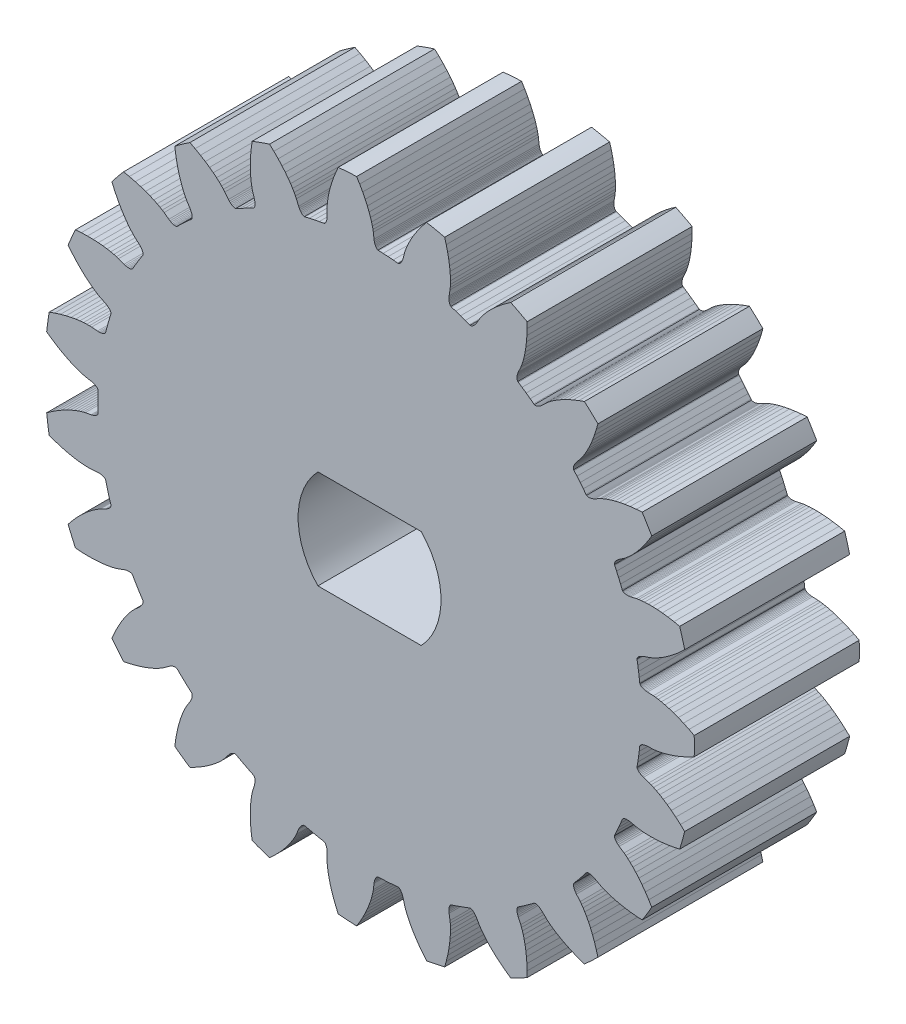
from build123d import *

# Parameters (mm, degrees)
BOSS_EXTRUDE1_DEPTH = 3.175


with BuildPart() as part:
    # Model → Boss-Extrude1 (new, symmetric)
    with BuildSketch(Plane.XY):
        with BuildLine():
            Line((11.7845341, 2.7201057), (11.9632091, 2.8748365))
            Line((11.9632091, 2.8748365), (12.127454742, 3.028948646))
            ThreePointArc((12.127454742, 3.028948646), (12.036454193, 3.372456246), (11.935725978, 3.713238284))
            Line((11.935725978, 3.713238284), (11.7153169, 3.7595754))
            Line((11.7153169, 3.7595754), (11.4822579, 3.7989437))
            Line((11.4822579, 3.7989437), (11.2654754, 3.8262914))
            Line((11.2654754, 3.8262914), (11.0678403, 3.8428655))
            Line((11.0678403, 3.8428655), (10.8876411, 3.8503975))
            Line((10.8876411, 3.8503975), (10.7260469, 3.8503874))
            Line((10.7260469, 3.8503874), (10.5840836, 3.8444145))
            Line((10.5840836, 3.8444145), (10.4619134, 3.8341631))
            Line((10.4619134, 3.8341631), (10.3588581, 3.82117))
            Line((10.3588581, 3.82117), (10.2752035, 3.807086))
            Line((10.2752035, 3.807086), (10.054994, 3.7556019))
            Line((10.054994, 3.7556019), (10.0021064, 3.7473918))
            Line((10.0021064, 3.7473918), (9.9533406, 3.7429453))
            Line((9.9533406, 3.7429453), (9.9088313, 3.742103))
            Line((9.9088313, 3.742103), (9.8687068, 3.7446699))
            Line((9.8687068, 3.7446699), (9.8330875, 3.7504692))
            Line((9.8330875, 3.7504692), (9.8020885, 3.7593112))
            Line((9.8020885, 3.7593112), (9.7758158, 3.771002))
            Line((9.7758158, 3.771002), (9.7543793, 3.7853386))
            Line((9.7543793, 3.7853386), (9.7378812, 3.8021364))
            Line((9.7378812, 3.8021364), (9.7243187, 3.8262821))
            Line((9.7243187, 3.8262821), (9.66005, 3.9858149))
            Line((9.66005, 3.9858149), (9.5848581, 4.1632914))
            Line((9.5848581, 4.1632914), (9.5064743, 4.3393815))
            Line((9.5064743, 4.3393815), (9.4337489, 4.495241))
            Line((9.4337489, 4.495241), (9.4253595, 4.5216336))
            Line((9.4253595, 4.5216336), (9.4243439, 4.5451565))
            Line((9.4243439, 4.5451565), (9.4284977, 4.5706085))
            Line((9.4284977, 4.5706085), (9.4378861, 4.5977891))
            Line((9.4378861, 4.5977891), (9.4525826, 4.6264794))
            Line((9.4525826, 4.6264794), (9.4726563, 4.6564697))
            Line((9.4726563, 4.6564697), (9.4981674, 4.6875461))
            Line((9.4981674, 4.6875461), (9.529163, 4.7195002))
            Line((9.529163, 4.7195002), (9.5656978, 4.752105))
            Line((9.5656978, 4.752105), (9.6077967, 4.7851533))
            Line((9.6077967, 4.7851533), (9.7957278, 4.9109498))
            Line((9.7957278, 4.9109498), (9.8631196, 4.9624744))
            Line((9.8631196, 4.9624744), (9.9429562, 5.0289225))
            Line((9.9429562, 5.0289225), (10.0338359, 5.1112117))
            Line((10.0338359, 5.1112117), (10.1350986, 5.2108869))
            Line((10.1350986, 5.2108869), (10.2454026, 5.3289788))
            Line((10.2454026, 5.3289788), (10.3628935, 5.4658158))
            Line((10.3628935, 5.4658158), (10.485677, 5.6215674))
            Line((10.485677, 5.6215674), (10.6136559, 5.7986661))
            Line((10.6136559, 5.7986661), (10.7439593, 5.9958649))
            Line((10.7439593, 5.9958649), (10.86053519, 6.188575018))
            ThreePointArc((10.86053519, 6.188575018), (10.680231999, 6.494792857), (10.491297213, 6.795761714))
            Line((10.491297213, 6.795761714), (10.2665599, 6.7809148))
            Line((10.2665599, 6.7809148), (10.0315219, 6.7559446))
            Line((10.0315219, 6.7559446), (9.8154, 6.723791))
            Line((9.8154, 6.723791), (9.6206221, 6.6864292))
            Line((9.6206221, 6.6864292), (9.445073, 6.6450647))
            Line((9.445073, 6.6450647), (9.289474, 6.6014574))
            Line((9.289474, 6.6014574), (9.1543864, 6.5574048))
            Line((9.1543864, 6.5574048), (9.0395125, 6.5145724))
            Line((9.0395125, 6.5145724), (8.9437842, 6.4742571))
            Line((8.9437842, 6.4742571), (8.8670316, 6.4381256))
            Line((8.8670316, 6.4381256), (8.6688782, 6.3291389))
            Line((8.6688782, 6.3291389), (8.620167, 6.3069643))
            Line((8.620167, 6.3069643), (8.5744092, 6.2895259))
            Line((8.5744092, 6.2895259), (8.5317777, 6.2767064))
            Line((8.5317777, 6.2767064), (8.4924486, 6.2683526))
            Line((8.4924486, 6.2683526), (8.4565854, 6.2643269))
            Line((8.4565854, 6.2643269), (8.4243504, 6.2644776))
            Line((8.4243504, 6.2644776), (8.3958978, 6.2686465))
            Line((8.3958978, 6.2686465), (8.3713884, 6.276668))
            Line((8.3713884, 6.276668), (8.35097, 6.2883918))
            Line((8.35097, 6.2883918), (8.3313961, 6.307983))
            Line((8.3313961, 6.307983), (8.2264691, 6.4442603))
            Line((8.2264691, 6.4442603), (8.106183, 6.594869))
            Line((8.106183, 6.594869), (7.9831974, 6.7432815))
            Line((7.9831974, 6.7432815), (7.8711184, 6.8737402))
            Line((7.8711184, 6.8737402), (7.8559194, 6.8968908))
            Line((7.8559194, 6.8968908), (7.8485951, 6.9192673))
            Line((7.8485951, 6.9192673), (7.845728, 6.9448961))
            Line((7.845728, 6.9448961), (7.8474351, 6.9736018))
            Line((7.8474351, 6.9736018), (7.853846, 7.0051933))
            Line((7.853846, 7.0051933), (7.865084, 7.0394872))
            Line((7.865084, 7.0394872), (7.8812648, 7.0762941))
            Line((7.8812648, 7.0762941), (7.9024899, 7.1154257))
            Line((7.9024899, 7.1154257), (7.9288732, 7.1566785))
            Line((7.9288732, 7.1566785), (7.9604946, 7.1998594))
            Line((7.9604946, 7.1998594), (8.1075173, 7.3716942))
            Line((8.1075173, 7.3716942), (8.1585088, 7.4394902))
            Line((8.1585088, 7.4394902), (8.2174573, 7.5250139))
            Line((8.2174573, 7.5250139), (8.2827656, 7.6287707))
            Line((8.2827656, 7.6287707), (8.3533812, 7.7520699))
            Line((8.3533812, 7.7520699), (8.427734, 7.8955423))
            Line((8.427734, 7.8955423), (8.5039498, 8.0590038))
            Line((8.5039498, 8.0590038), (8.5801589, 8.2421062))
            Line((8.5801589, 8.2421062), (8.6556113, 8.4471659))
            Line((8.6556113, 8.4471659), (8.7278791, 8.6722075))
            Line((8.7278791, 8.6722075), (8.788139523, 8.889223122))
            ThreePointArc((8.788139523, 8.889223122), (8.531905926, 9.135440416), (8.268776972, 9.374274596))
            Line((8.268776972, 9.374274596), (8.0563791, 9.2993448))
            Line((8.0563791, 9.2993448), (7.8367938, 9.2118881))
            Line((7.8367938, 9.2118881), (7.6373612, 9.1226178))
            Line((7.6373612, 9.1226178), (7.4598863, 9.034091))
            Line((7.4598863, 9.034091), (7.3020071, 8.9468979))
            Line((7.3020071, 8.9468979), (7.1639432, 8.8629275))
            Line((7.1639432, 8.8629275), (7.0457503, 8.7840623))
            Line((7.0457503, 8.7840623), (6.9466923, 8.7118257))
            Line((6.9466923, 8.7118257), (6.8653907, 8.6471782))
            Line((6.8653907, 8.6471782), (6.8012325, 8.591679))
            Line((6.8012325, 8.591679), (6.6398315, 8.4332727))
            Line((6.6398315, 8.4332727), (6.5989092, 8.3987782))
            Line((6.5989092, 8.3987782), (6.5595531, 8.3696411))
            Line((6.5595531, 8.3696411), (6.5219611, 8.3457952))
            Line((6.5219611, 8.3457952), (6.4863442, 8.3271403))
            Line((6.4863442, 8.3271403), (6.4528971, 8.3135881))
            Line((6.4528971, 8.3135881), (6.4218168, 8.3050363))
            Line((6.4218168, 8.3050363), (6.3932946, 8.3013742))
            Line((6.3932946, 8.3013742), (6.3675298, 8.3024857))
            Line((6.3675298, 8.3024857), (6.3447056, 8.3082659))
            Line((6.3447056, 8.3082659), (6.3205719, 8.3218496))
            Line((6.3205719, 8.3218496), (6.1827687, 8.4247645))
            Line((6.1827687, 8.4247645), (6.0263094, 8.5373354))
            Line((6.0263094, 8.5373354), (5.8678432, 8.6470632))
            Line((5.8678432, 8.6470632), (5.724723, 8.7424456))
            Line((5.724723, 8.7424456), (5.7038418, 8.760637))
            Line((5.7038418, 8.760637), (5.6907519, 8.7802077))
            Line((5.6907519, 8.7802077), (5.6810766, 8.8041126))
            Line((5.6810766, 8.8041126), (5.6749756, 8.8322144))
            Line((5.6749756, 8.8322144), (5.6726255, 8.864364))
            Line((5.6726255, 8.864364), (5.6741945, 8.9004182))
            Line((5.6741945, 8.9004182), (5.6798449, 8.9402257))
            Line((5.6798449, 8.9402257), (5.6897252, 8.9836327))
            Line((5.6897252, 8.9836327), (5.7040004, 9.0304738))
            Line((5.7040004, 9.0304738), (5.7227991, 9.0805848))
            Line((5.7227991, 9.0805848), (5.8180092, 9.2857137))
            Line((5.8180092, 9.2857137), (5.8488187, 9.3647531))
            Line((5.8488187, 9.3647531), (5.8825073, 9.4630094))
            Line((5.8825073, 9.4630094), (5.9174005, 9.5805386))
            Line((5.9174005, 9.5805386), (5.9521317, 9.7183174))
            Line((5.9521317, 9.7183174), (5.9850189, 9.8765296))
            Line((5.9850189, 9.8765296), (6.0143071, 10.0544922))
            Line((6.0143071, 10.0544922), (6.0382897, 10.2513657))
            Line((6.0382897, 10.2513657), (6.0556197, 10.4691781))
            Line((6.0556197, 10.4691781), (6.0644921, 10.7053722))
            Line((6.0644921, 10.7053722), (6.063967799, 10.930598881))
            ThreePointArc((6.063967799, 10.930598881), (5.750807187, 11.098554299), (5.43299887, 11.257540039))
            Line((5.43299887, 11.257540039), (5.2486935, 11.1280849))
            Line((5.2486935, 11.1280849), (5.0608466, 10.984628))
            Line((5.0608466, 10.984628), (4.8928943, 10.8448618))
            Line((4.8928943, 10.8448618), (4.7458849, 10.7117356))
            Line((4.7458849, 10.7117356), (4.6173847, 10.5851806))
            Line((4.6173847, 10.5851806), (4.5070955, 10.4670749))
            Line((4.5070955, 10.4670749), (4.4145631, 10.3592461))
            Line((4.4145631, 10.3592461), (4.3386676, 10.2629627))
            Line((4.3386676, 10.2629627), (4.2778226, 10.1787776))
            Line((4.2778226, 10.1787776), (4.2310171, 10.1080268))
            Line((4.2310171, 10.1080268), (4.1183388, 9.9119491))
            Line((4.1183388, 9.9119491), (4.0882405, 9.8676931))
            Line((4.0882405, 9.8676931), (4.0582049, 9.8290184))
            Line((4.0582049, 9.8290184), (4.0284405, 9.7959145))
            Line((4.0284405, 9.7959145), (3.9991774, 9.7683421))
            Line((3.9991774, 9.7683421), (3.970627, 9.7462685))
            Line((3.970627, 9.7462685), (3.9430065, 9.7296485))
            Line((3.9430065, 9.7296485), (3.9165299, 9.718427))
            Line((3.9165299, 9.718427), (3.8914207, 9.712546))
            Line((3.8914207, 9.712546), (3.8678834, 9.711954))
            Line((3.8678834, 9.711954), (3.8409798, 9.7185227))
            Line((3.8409798, 9.7185227), (3.6805206, 9.7804424))
            Line((3.6805206, 9.7804424), (3.4994919, 9.8466266))
            Line((3.4994919, 9.8466266), (3.3172979, 9.9095318))
            Line((3.3172979, 9.9095318), (3.1537512, 9.9627638))
            Line((3.1537512, 9.9627638), (3.1287362, 9.9746469))
            Line((3.1287362, 9.9746469), (3.1108517, 9.9899603))
            Line((3.1108517, 9.9899603), (3.0950857, 10.0103684))
            Line((3.0950857, 10.0103684), (3.0816292, 10.035782))
            Line((3.0816292, 10.035782), (3.0706924, 10.0661054))
            Line((3.0706924, 10.0661054), (3.0624758, 10.1012459))
            Line((3.0624758, 10.1012459), (3.0571768, 10.1411017))
            Line((3.0571768, 10.1411017), (3.0549797, 10.1855647))
            Line((3.0549797, 10.1855647), (3.0560879, 10.2345202))
            Line((3.0560879, 10.2345202), (3.0606697, 10.2878448))
            Line((3.0606697, 10.2878448), (3.0970061, 10.5110544))
            Line((3.0970061, 10.5110544), (3.1053485, 10.595475))
            Line((3.1053485, 10.595475), (3.1112785, 10.6991769))
            Line((3.1112785, 10.6991769), (3.1131689, 10.8217618))
            Line((3.1131689, 10.8217618), (3.1094399, 10.9638018))
            Line((3.1094399, 10.9638018), (3.0984224, 11.1250199))
            Line((3.0984224, 11.1250199), (3.0786107, 11.304285))
            Line((3.0786107, 11.304285), (3.0485882, 11.5003283))
            Line((3.0485882, 11.5003283), (3.0065105, 11.7147392))
            Line((3.0065105, 11.7147392), (2.9513294, 11.9445683))
            Line((2.9513294, 11.9445683), (2.890059148, 12.161301485))
            ThreePointArc((2.890059148, 12.161301485), (2.543197546, 12.238539014), (2.194280578, 12.305885551))
            Line((2.194280578, 12.305885551), (2.0517363, 12.1315059))
            Line((2.0517363, 12.1315059), (1.9095595, 11.9426882))
            Line((1.9095595, 11.9426882), (1.7855438, 11.762792))
            Line((1.7855438, 11.762792), (1.6799029, 11.5949399))
            Line((1.6799029, 11.5949399), (1.590312, 11.4384088))
            Line((1.590312, 11.4384088), (1.5159772, 11.2949271))
            Line((1.5159772, 11.2949271), (1.455968, 11.1661321))
            Line((1.455968, 11.1661321), (1.4088639, 11.0529427))
            Line((1.4088639, 11.0529427), (1.372988, 10.9554637))
            Line((1.372988, 10.9554637), (1.3470065, 10.8747085))
            Line((1.3470065, 10.8747085), (1.2914077, 10.6555017))
            Line((1.2914077, 10.6555017), (1.2743657, 10.6047664))
            Line((1.2743657, 10.6047664), (1.2558782, 10.5594223))
            Line((1.2558782, 10.5594223), (1.2361489, 10.5195156))
            Line((1.2361489, 10.5195156), (1.2154099, 10.4850706))
            Line((1.2154099, 10.4850706), (1.1938736, 10.4561128))
            Line((1.1938736, 10.4561128), (1.1717613, 10.4326571))
            Line((1.1717613, 10.4326571), (1.1492941, 10.4147085))
            Line((1.1492941, 10.4147085), (1.1267027, 10.4022712))
            Line((1.1267027, 10.4022712), (1.104198, 10.3953508))
            Line((1.104198, 10.3953508), (1.0765198, 10.3944175))
            Line((1.0765198, 10.3944175), (0.9053052, 10.4107497))
            Line((0.9053052, 10.4107497), (0.7131332, 10.4256386))
            Line((0.7131332, 10.4256386), (0.5207238, 10.4370557))
            Line((0.5207238, 10.4370557), (0.34888, 10.4441894))
            Line((0.34888, 10.4441894), (0.3215867, 10.4488829))
            Line((0.3215867, 10.4488829), (0.3002339, 10.4588032))
            Line((0.3002339, 10.4588032), (0.2795464, 10.4742009))
            Line((0.2795464, 10.4742009), (0.2597325, 10.4950416))
            Line((0.2597325, 10.4950416), (0.2410201, 10.5212898))
            Line((0.2410201, 10.5212898), (0.2236274, 10.5529104))
            Line((0.2236274, 10.5529104), (0.2077719, 10.5898586))
            Line((0.2077719, 10.5898586), (0.1936603, 10.63208))
            Line((0.1936603, 10.63208), (0.1815193, 10.6795191))
            Line((0.1815193, 10.6795191), (0.1715445, 10.7321024))
            Line((0.1715445, 10.7321024), (0.1463122, 10.9568382))
            Line((0.1463122, 10.9568382), (0.1315688, 11.0403791))
            Line((0.1315688, 11.0403791), (0.1093005, 11.1418353))
            Line((0.1093005, 11.1418353), (0.0780478, 11.2603844))
            Line((0.0780478, 11.2603844), (0.0361351, 11.3961511))
            Line((0.0361351, 11.3961511), (-0.01797, 11.5484183))
            Line((-0.01797, 11.5484183), (-0.0854121, 11.7156907))
            Line((-0.0854121, 11.7156907), (-0.1672132, 11.8963642))
            Line((-0.1672132, 11.8963642), (-0.2655779, 12.0914717))
            Line((-0.2655779, 12.0914717), (-0.3807198, 12.2978905))
            Line((-0.3807198, 12.2978905), (-0.49819194, 12.490055965))
            ThreePointArc((-0.49819194, 12.490055965), (-0.853029389, 12.470847266), (-1.207177431, 12.44155983))
            Line((-1.207177431, 12.44155983), (-1.2973888, 12.2351886))
            Line((-1.2973888, 12.2351886), (-1.3833509, 12.0150139))
            Line((-1.3833509, 12.0150139), (-1.4542323, 11.8083297))
            Line((-1.4542323, 11.8083297), (-1.5106698, 11.6182004))
            Line((-1.5106698, 11.6182004), (-1.5547068, 11.4433027))
            Line((-1.5547068, 11.4433027), (-1.5875742, 11.2850864))
            Line((-1.5875742, 11.2850864), (-1.6106096, 11.1448771))
            Line((-1.6106096, 11.1448771), (-1.6254289, 11.0231765))
            Line((-1.6254289, 11.0231765), (-1.6336748, 10.9196331))
            Line((-1.6336748, 10.9196331), (-1.6369054, 10.8348628))
            Line((-1.6369054, 10.8348628), (-1.6313011, 10.6087844))
            Line((-1.6313011, 10.6087844), (-1.634023, 10.5553326))
            Line((-1.634023, 10.5553326), (-1.6395912, 10.5066822))
            Line((-1.6395912, 10.5066822), (-1.6478222, 10.4629324))
            Line((-1.6478222, 10.4629324), (-1.658499, 10.4241694))
            Line((-1.658499, 10.4241694), (-1.671424, 10.390475))
            Line((-1.671424, 10.390475), (-1.6863879, 10.3619233))
            Line((-1.6863879, 10.3619233), (-1.7031796, 10.3385787))
            Line((-1.7031796, 10.3385787), (-1.7215777, 10.3205075))
            Line((-1.7215777, 10.3205075), (-1.7413808, 10.3077721))
            Line((-1.7413808, 10.3077721), (-1.7677808, 10.2994058))
            Line((-1.7677808, 10.2994058), (-1.9370527, 10.2689392))
            Line((-1.9370527, 10.2689392), (-2.1261153, 10.2314287))
            Line((-2.1261153, 10.2314287), (-2.31447, 10.190511))
            Line((-2.31447, 10.190511), (-2.481866, 10.1510172))
            Line((-2.481866, 10.1510172), (-2.5094135, 10.148173))
            Line((-2.5094135, 10.148173), (-2.5326509, 10.1519645))
            Line((-2.5326509, 10.1519645), (-2.5567255, 10.1612098))
            Line((-2.5567255, 10.1612098), (-2.5814275, 10.175932))
            Line((-2.5814275, 10.175932), (-2.6065276, 10.1961582))
            Line((-2.6065276, 10.1961582), (-2.6318065, 10.2219138))
            Line((-2.6318065, 10.2219138), (-2.6570425, 10.253214))
            Line((-2.6570425, 10.253214), (-2.682022, 10.2900625))
            Line((-2.682022, 10.2900625), (-2.7065117, 10.3324669))
            Line((-2.7065117, 10.3324669), (-2.7303034, 10.3804091))
            Line((-2.7303034, 10.3804091), (-2.8152331, 10.5900035))
            Line((-2.8152331, 10.5900035), (-2.8519687, 10.6664687))
            Line((-2.8519687, 10.6664687), (-2.9007838, 10.7581547))
            Line((-2.9007838, 10.7581547), (-2.9628618, 10.8638758))
            Line((-2.9628618, 10.8638758), (-3.0398497, 10.9833))
            Line((-3.0398497, 10.9833), (-3.1330296, 11.1153234))
            Line((-3.1330296, 11.1153234), (-3.2431003, 11.2581972))
            Line((-3.2431003, 11.2581972), (-3.3706131, 11.4101012))
            Line((-3.3706131, 11.4101012), (-3.5179696, 11.5714351))
            Line((-3.5179696, 11.5714351), (-3.6845328, 11.7391343))
            Line((-3.6845328, 11.7391343), (-3.8494943, 11.8924802))
            ThreePointArc((-3.8494943, 11.8924802), (-4.185991025, 11.778249896), (-4.5191047, 11.6545006))
            Line((-4.5191047, 11.6545006), (-4.5502924, 11.4314433))
            Line((-4.5502924, 11.4314433), (-4.5736644, 11.196241))
            Line((-4.5736644, 11.196241), (-4.5861546, 10.9780976))
            Line((-4.5861546, 10.9780976), (-4.589203, 10.7797922))
            Line((-4.589203, 10.7797922), (-4.5844202, 10.5994991))
            Line((-4.5844202, 10.5994991), (-4.5733825, 10.4382823))
            Line((-4.5733825, 10.4382823), (-4.5577357, 10.2970575))
            Line((-4.5577357, 10.2970575), (-4.539171, 10.1758718))
            Line((-4.539171, 10.1758718), (-4.5191755, 10.0739433))
            Line((-4.5191755, 10.0739433), (-4.4994155, 9.9914449))
            Line((-4.4994155, 9.9914449), (-4.4330238, 9.7752621))
            Line((-4.4330238, 9.7752621), (-4.4212236, 9.7230581))
            Line((-4.4212236, 9.7230581), (-4.4134596, 9.6747095))
            Line((-4.4134596, 9.6747095), (-4.4095819, 9.6303614))
            Line((-4.4095819, 9.6303614), (-4.4094046, 9.5901553))
            Line((-4.4094046, 9.5901553), (-4.4127596, 9.5542232))
            Line((-4.4127596, 9.5542232), (-4.4194656, 9.5226931))
            Line((-4.4194656, 9.5226931), (-4.4293362, 9.4956838))
            Line((-4.4293362, 9.4956838), (-4.4421765, 9.473319))
            Line((-4.4421765, 9.473319), (-4.4578093, 9.455713))
            Line((-4.4578093, 9.455713), (-4.4809731, 9.4405344))
            Line((-4.4809731, 9.4405344), (-4.6357481, 9.3655285))
            Line((-4.6357481, 9.3655285), (-4.8076796, 9.2784005))
            Line((-4.8076796, 9.2784005), (-4.9780101, 9.1881827))
            Line((-4.9780101, 9.1881827), (-5.1285433, 9.1049905))
            Line((-5.1285433, 9.1049905), (-5.154302, 9.0948196))
            Line((-5.154302, 9.0948196), (-5.1777006, 9.0922011))
            Line((-5.1777006, 9.0922011), (-5.2033768, 9.0946083))
            Line((-5.2033768, 9.0946083), (-5.2311347, 9.10212))
            Line((-5.2311347, 9.10212), (-5.2607611, 9.1148243))
            Line((-5.2607611, 9.1148243), (-5.2920513, 9.1328046))
            Line((-5.2920513, 9.1328046), (-5.3247962, 9.1561356))
            Line((-5.3247962, 9.1561356), (-5.358791, 9.1848782))
            Line((-5.358791, 9.1848782), (-5.3938131, 9.2191029))
            Line((-5.3938131, 9.2191029), (-5.4296572, 9.2588483))
            Line((-5.4296572, 9.2588483), (-5.5679853, 9.4377566))
            Line((-5.5679853, 9.4377566), (-5.6239888, 9.5014752))
            Line((-5.6239888, 9.5014752), (-5.6957303, 9.576591))
            Line((-5.6957303, 9.576591), (-5.7840295, 9.6616433))
            Line((-5.7840295, 9.6616433), (-5.8903827, 9.7558679))
            Line((-5.8903827, 9.7558679), (-6.0157267, 9.8578558))
            Line((-6.0157267, 9.8578558), (-6.1602626, 9.9657347))
            Line((-6.1602626, 9.9657347), (-6.3240301, 10.0776031))
            Line((-6.3240301, 10.0776031), (-6.5094495, 10.193198))
            Line((-6.5094495, 10.193198), (-6.7150809, 10.3097403))
            Line((-6.7150809, 10.3097403), (-6.915297648, 10.412893728))
            ThreePointArc((-6.915297648, 10.412893728), (-7.208497005, 10.212113457), (-7.495870563, 10.003079924))
            Line((-7.495870563, 10.003079924), (-7.4657217, 9.7798802))
            Line((-7.4657217, 9.7798802), (-7.4247702, 9.5470941))
            Line((-7.4247702, 9.5470941), (-7.3779429, 9.3336703))
            Line((-7.3779429, 9.3336703), (-7.327376, 9.1418961))
            Line((-7.327376, 9.1418961), (-7.2741281, 8.9695791))
            Line((-7.2741281, 8.9695791), (-7.220004, 8.8173187))
            Line((-7.220004, 8.8173187), (-7.1668354, 8.6855523))
            Line((-7.1668354, 8.6855523), (-7.1162636, 8.5738692))
            Line((-7.1162636, 8.5738692), (-7.0695096, 8.4811152))
            Line((-7.0695096, 8.4811152), (-7.0282245, 8.4070073))
            Line((-7.0282245, 8.4070073), (-6.9059694, 8.2167534))
            Line((-6.9059694, 8.2167534), (-6.8805223, 8.1696689))
            Line((-6.8805223, 8.1696689), (-6.860002, 8.1252078))
            Line((-6.860002, 8.1252078), (-6.844303, 8.0835505))
            Line((-6.844303, 8.0835505), (-6.8332848, 8.0448832))
            Line((-6.8332848, 8.0448832), (-6.8268211, 8.0093784))
            Line((-6.8268211, 8.0093784), (-6.8247716, 7.9772082))
            Line((-6.8247716, 7.9772082), (-6.8269892, 7.9485375))
            Line((-6.8269892, 7.9485375), (-6.8333194, 7.9235377))
            Line((-6.8333194, 7.9235377), (-6.8436225, 7.902367))
            Line((-6.8436225, 7.902367), (-6.8618322, 7.8815017))
            Line((-6.8618322, 7.8815017), (-6.9906314, 7.7675195))
            Line((-6.9906314, 7.7675195), (-7.1326803, 7.6372358))
            Line((-7.1326803, 7.6372358), (-7.272354, 7.5044089))
            Line((-7.272354, 7.5044089), (-7.3948601, 7.3836884))
            Line((-7.3948601, 7.3836884), (-7.4169194, 7.366945))
            Line((-7.4169194, 7.366945), (-7.4387439, 7.3581107))
            Line((-7.4387439, 7.3581107), (-7.4641174, 7.3535013))
            Line((-7.4641174, 7.3535013), (-7.4928726, 7.3532455))
            Line((-7.4928726, 7.3532455), (-7.5248279, 7.3574855))
            Line((-7.5248279, 7.3574855), (-7.5598089, 7.3663571))
            Line((-7.5598089, 7.3663571), (-7.5976341, 7.3799884))
            Line((-7.5976341, 7.3799884), (-7.638123, 7.3984935))
            Line((-7.638123, 7.3984935), (-7.6810801, 7.4220002))
            Line((-7.6810801, 7.4220002), (-7.7263182, 7.4506011))
            Line((-7.7263182, 7.4506011), (-7.9077856, 7.5855546))
            Line((-7.9077856, 7.5855546), (-7.9789034, 7.6318007))
            Line((-7.9789034, 7.6318007), (-8.0682505, 7.6847754))
            Line((-8.0682505, 7.6847754), (-8.1762221, 7.7428509))
            Line((-8.1762221, 7.7428509), (-8.304053, 7.8048876))
            Line((-8.304053, 7.8048876), (-8.4522649, 7.8692761))
            Line((-8.4522649, 7.8692761), (-8.6205464, 7.9341593))
            Line((-8.6205464, 7.9341593), (-8.8084227, 7.9976954))
            Line((-8.8084227, 7.9976954), (-9.0181534, 8.0589781))
            Line((-9.0181534, 8.0589781), (-9.2476021, 8.1157201))
            Line((-9.2476021, 8.1157201), (-9.468224658, 8.161030453))
            ThreePointArc((-9.468224658, 8.161030453), (-9.69638161, 7.88859142), (-9.916702096, 7.609776958))
            Line((-9.916702096, 7.609776958), (-9.8274526, 7.4029881))
            Line((-9.8274526, 7.4029881), (-9.7252148, 7.1898829))
            Line((-9.7252148, 7.1898829), (-9.6225428, 6.9970073))
            Line((-9.6225428, 6.9970073), (-9.5221111, 6.8259874))
            Line((-9.5221111, 6.8259874), (-9.4243472, 6.6744265))
            Line((-9.4243472, 6.6744265), (-9.3311508, 6.5424148))
            Line((-9.3311508, 6.5424148), (-9.2444036, 6.4298794))
            Line((-9.2444036, 6.4298794), (-9.1655754, 6.3359819))
            Line((-9.1655754, 6.3359819), (-9.0955305, 6.2592816))
            Line((-9.0955305, 6.2592816), (-9.0357823, 6.1990604))
            Line((-9.0357823, 6.1990604), (-8.8667309, 6.0488456))
            Line((-8.8667309, 6.0488456), (-8.8295242, 6.0103727))
            Line((-8.8295242, 6.0103727), (-8.7977693, 5.9730967))
            Line((-8.7977693, 5.9730967), (-8.7714136, 5.9372197))
            Line((-8.7714136, 5.9372197), (-8.7503716, 5.9029589))
            Line((-8.7503716, 5.9029589), (-8.7345685, 5.8705146))
            Line((-8.7345685, 5.8705146), (-8.7239156, 5.8400904))
            Line((-8.7239156, 5.8400904), (-8.7183157, 5.8118845))
            Line((-8.7183157, 5.8118845), (-8.7176663, 5.786104))
            Line((-8.7176663, 5.786104), (-8.7218755, 5.7629385))
            Line((-8.7218755, 5.7629385), (-8.7337805, 5.737934))
            Line((-8.7337805, 5.737934), (-8.8270515, 5.593429))
            Line((-8.8270515, 5.593429), (-8.9286828, 5.4296523))
            Line((-8.9286828, 5.4296523), (-9.0273407, 5.2640674))
            Line((-9.0273407, 5.2640674), (-9.1127339, 5.1147718))
            Line((-9.1127339, 5.1147718), (-9.1294579, 5.0926978))
            Line((-9.1294579, 5.0926978), (-9.1480896, 5.0783029))
            Line((-9.1480896, 5.0783029), (-9.1712786, 5.0670188))
            Line((-9.1712786, 5.0670188), (-9.1988985, 5.0590143))
            Line((-9.1988985, 5.0590143), (-9.2308127, 5.0544757))
            Line((-9.2308127, 5.0544757), (-9.26689, 5.0535806))
            Line((-9.26689, 5.0535806), (-9.3069903, 5.0565012))
            Line((-9.3069903, 5.0565012), (-9.3509703, 5.0633964))
            Line((-9.3509703, 5.0633964), (-9.3986765, 5.0744417))
            Line((-9.3986765, 5.0744417), (-9.4499535, 5.0897769))
            Line((-9.4499535, 5.0897769), (-9.6611016, 5.1707666))
            Line((-9.6611016, 5.1707666), (-9.7420592, 5.1961104))
            Line((-9.7420592, 5.1961104), (-9.8423855, 5.2230152))
            Line((-9.8423855, 5.2230152), (-9.9620218, 5.2498066))
            Line((-9.9620218, 5.2498066), (-10.1018496, 5.2750545))
            Line((-10.1018496, 5.2750545), (-10.2619373, 5.2970683))
            Line((-10.2619373, 5.2970683), (-10.4414837, 5.3141435))
            Line((-10.4414837, 5.3141435), (-10.6395349, 5.3246351))
            Line((-10.6395349, 5.3246351), (-10.8580221, 5.3270607))
            Line((-10.8580221, 5.3270607), (-11.094271, 5.3197939))
            Line((-11.094271, 5.3197939), (-11.318936793, 5.303900786))
            ThreePointArc((-11.318936793, 5.303900786), (-11.465129953, 4.980008598), (-11.602057178, 4.65209165))
            Line((-11.602057178, 4.65209165), (-11.4603263, 4.4770502))
            Line((-11.4603263, 4.4770502), (-11.3043846, 4.299431))
            Line((-11.3043846, 4.299431), (-11.1534828, 4.1414083))
            Line((-11.1534828, 4.1414083), (-11.0106348, 4.0038265))
            Line((-11.0106348, 4.0038265), (-10.8756055, 3.8842622))
            Line((-10.8756055, 3.8842622), (-10.7502488, 3.78229))
            Line((-10.7502488, 3.78229), (-10.6363568, 3.6973318))
            Line((-10.6363568, 3.6973318), (-10.5351185, 3.6281838))
            Line((-10.5351185, 3.6281838), (-10.4469775, 3.5732257))
            Line((-10.4469775, 3.5732257), (-10.3731975, 3.5313575))
            Line((-10.3731975, 3.5313575), (-10.1698875, 3.4323226))
            Line((-10.1698875, 3.4323226), (-10.1236806, 3.4053147))
            Line((-10.1236806, 3.4053147), (-10.0830464, 3.3779883))
            Line((-10.0830464, 3.3779883), (-10.0479884, 3.3505524))
            Line((-10.0479884, 3.3505524), (-10.0184833, 3.3232392))
            Line((-10.0184833, 3.3232392), (-9.9945129, 3.2962616))
            Line((-9.9945129, 3.2962616), (-9.9760467, 3.2698397))
            Line((-9.9760467, 3.2698397), (-9.9630446, 3.2441906))
            Line((-9.9630446, 3.2441906), (-9.9554638, 3.2195413))
            Line((-9.9554638, 3.2195413), (-9.9532669, 3.1960993))
            Line((-9.9532669, 3.1960993), (-9.9579843, 3.1688101))
            Line((-9.9579843, 3.1688101), (-10.0088095, 3.0044995))
            Line((-10.0088095, 3.0044995), (-10.0624857, 2.8193763))
            Line((-10.0624857, 2.8193763), (-10.1128108, 2.6333141))
            Line((-10.1128108, 2.6333141), (-10.1547579, 2.466516))
            Line((-10.1547579, 2.466516), (-10.1649062, 2.4407485))
            Line((-10.1649062, 2.4407485), (-10.1789634, 2.4218606))
            Line((-10.1789634, 2.4218606), (-10.198248, 2.4047386))
            Line((-10.198248, 2.4047386), (-10.2226841, 2.3895792))
            Line((-10.2226841, 2.3895792), (-10.2521904, 2.3765986))
            Line((-10.2521904, 2.3765986), (-10.2866883, 2.3660031))
            Line((-10.2866883, 2.3660031), (-10.3260896, 2.3579965))
            Line((-10.3260896, 2.3579965), (-10.370299, 2.3527703))
            Line((-10.370299, 2.3527703), (-10.419216, 2.3505351))
            Line((-10.419216, 2.3505351), (-10.4727289, 2.3514672))
            Line((-10.4727289, 2.3514672), (-10.6978979, 2.3724865))
            Line((-10.6978979, 2.3724865), (-10.782691, 2.3750485))
            Line((-10.782691, 2.3750485), (-10.8865558, 2.3738878))
            Line((-10.8865558, 2.3738878), (-11.0089839, 2.3674082))
            Line((-11.0089839, 2.3674082), (-11.1504383, 2.3539948))
            Line((-11.1504383, 2.3539948), (-11.3105287, 2.3320011))
            Line((-11.3105287, 2.3320011), (-11.488024, 2.3000021))
            Line((-11.488024, 2.3000021), (-11.6815614, 2.256671))
            Line((-11.6815614, 2.256671), (-11.892601, 2.2000595))
            Line((-11.892601, 2.2000595), (-12.1181286, 2.129323))
            Line((-12.1181286, 2.129323), (-12.3301751, 2.0534052))
            ThreePointArc((-12.3301751, 2.0534052), (-12.383562047, 1.702081397), (-12.4269408, 1.349382))
            Line((-12.4269408, 1.349382), (-12.24324, 1.21907))
            Line((-12.24324, 1.21907), (-12.04516, 1.09011))
            Line((-12.04516, 1.09011), (-11.85722, 0.97866))
            Line((-11.85722, 0.97866), (-11.68255, 0.88472))
            Line((-11.68255, 0.88472), (-11.52027, 0.80602))
            Line((-11.52027, 0.80602), (-11.37205, 0.74165))
            Line((-11.37205, 0.74165), (-11.23946, 0.69057))
            Line((-11.23946, 0.69057), (-11.12332, 0.6513))
            Line((-11.12332, 0.6513), (-11.02362, 0.62216))
            Line((-11.02362, 0.62216), (-10.94128, 0.60175))
            Line((-10.94128, 0.60175), (-10.71879, 0.56124))
            Line((-10.71879, 0.56124), (-10.66701, 0.5477))
            Line((-10.66701, 0.5477), (-10.62051, 0.53235))
            Line((-10.62051, 0.53235), (-10.57935, 0.51539))
            Line((-10.57935, 0.51539), (-10.54357, 0.49705))
            Line((-10.54357, 0.49705), (-10.51321, 0.47754))
            Line((-10.51321, 0.47754), (-10.4883, 0.45708))
            Line((-10.4883, 0.45708), (-10.46886, 0.43589))
            Line((-10.46886, 0.43589), (-10.45491, 0.4142))
            Line((-10.45491, 0.4142), (-10.44647, 0.39222))
            Line((-10.44647, 0.39222), (-10.44365, 0.36467))
            Line((-10.44365, 0.36467), (-10.44826, 0.19274))
            Line((-10.44826, 0.19274), (-10.45, 0))
            Line((-10.45, 0), (-10.44826, -0.19274))
            Line((-10.44826, -0.19274), (-10.44365, -0.36467))
            Line((-10.44365, -0.36467), (-10.44647, -0.39222))
            Line((-10.44647, -0.39222), (-10.45491, -0.4142))
            Line((-10.45491, -0.4142), (-10.46886, -0.43589))
            Line((-10.46886, -0.43589), (-10.4883, -0.45708))
            Line((-10.4883, -0.45708), (-10.51321, -0.47754))
            Line((-10.51321, -0.47754), (-10.54357, -0.49705))
            Line((-10.54357, -0.49705), (-10.57935, -0.51539))
            Line((-10.57935, -0.51539), (-10.62051, -0.53235))
            Line((-10.62051, -0.53235), (-10.66701, -0.5477))
            Line((-10.66701, -0.5477), (-10.71879, -0.56124))
            Line((-10.71879, -0.56124), (-10.94128, -0.60175))
            Line((-10.94128, -0.60175), (-11.02362, -0.62216))
            Line((-11.02362, -0.62216), (-11.12332, -0.6513))
            Line((-11.12332, -0.6513), (-11.23946, -0.69057))
            Line((-11.23946, -0.69057), (-11.37205, -0.74165))
            Line((-11.37205, -0.74165), (-11.52027, -0.80602))
            Line((-11.52027, -0.80602), (-11.68255, -0.88472))
            Line((-11.68255, -0.88472), (-11.85722, -0.97866))
            Line((-11.85722, -0.97866), (-12.04516, -1.09011))
            Line((-12.04516, -1.09011), (-12.24324, -1.21907))
            Line((-12.24324, -1.21907), (-12.426941046, -1.349382175))
            ThreePointArc((-12.426941046, -1.349382175), (-12.383562028, -1.702081539), (-12.330174816, -2.053405302))
            Line((-12.330174816, -2.053405302), (-12.1181286, -2.129323))
            Line((-12.1181286, -2.129323), (-11.892601, -2.2000595))
            Line((-11.892601, -2.2000595), (-11.6815614, -2.256671))
            Line((-11.6815614, -2.256671), (-11.488024, -2.3000021))
            Line((-11.488024, -2.3000021), (-11.3105287, -2.3320011))
            Line((-11.3105287, -2.3320011), (-11.1504383, -2.3539948))
            Line((-11.1504383, -2.3539948), (-11.0089839, -2.3674082))
            Line((-11.0089839, -2.3674082), (-10.8865558, -2.3738878))
            Line((-10.8865558, -2.3738878), (-10.782691, -2.3750485))
            Line((-10.782691, -2.3750485), (-10.6978979, -2.3724865))
            Line((-10.6978979, -2.3724865), (-10.4727289, -2.3514672))
            Line((-10.4727289, -2.3514672), (-10.419216, -2.3505351))
            Line((-10.419216, -2.3505351), (-10.370299, -2.3527703))
            Line((-10.370299, -2.3527703), (-10.3260896, -2.3579965))
            Line((-10.3260896, -2.3579965), (-10.2866883, -2.3660031))
            Line((-10.2866883, -2.3660031), (-10.2521904, -2.3765986))
            Line((-10.2521904, -2.3765986), (-10.2226841, -2.3895792))
            Line((-10.2226841, -2.3895792), (-10.198248, -2.4047386))
            Line((-10.198248, -2.4047386), (-10.1789634, -2.4218606))
            Line((-10.1789634, -2.4218606), (-10.1649062, -2.4407485))
            Line((-10.1649062, -2.4407485), (-10.1547579, -2.466516))
            Line((-10.1547579, -2.466516), (-10.1128108, -2.6333141))
            Line((-10.1128108, -2.6333141), (-10.0624857, -2.8193763))
            Line((-10.0624857, -2.8193763), (-10.0088095, -3.0044995))
            Line((-10.0088095, -3.0044995), (-9.9579843, -3.1688101))
            Line((-9.9579843, -3.1688101), (-9.9532669, -3.1960993))
            Line((-9.9532669, -3.1960993), (-9.9554638, -3.2195413))
            Line((-9.9554638, -3.2195413), (-9.9630446, -3.2441906))
            Line((-9.9630446, -3.2441906), (-9.9760467, -3.2698397))
            Line((-9.9760467, -3.2698397), (-9.9945129, -3.2962616))
            Line((-9.9945129, -3.2962616), (-10.0184833, -3.3232392))
            Line((-10.0184833, -3.3232392), (-10.0479884, -3.3505524))
            Line((-10.0479884, -3.3505524), (-10.0830464, -3.3779883))
            Line((-10.0830464, -3.3779883), (-10.1236806, -3.4053147))
            Line((-10.1236806, -3.4053147), (-10.1698875, -3.4323226))
            Line((-10.1698875, -3.4323226), (-10.3731975, -3.5313575))
            Line((-10.3731975, -3.5313575), (-10.4469775, -3.5732257))
            Line((-10.4469775, -3.5732257), (-10.5351185, -3.6281838))
            Line((-10.5351185, -3.6281838), (-10.6363568, -3.6973318))
            Line((-10.6363568, -3.6973318), (-10.7502488, -3.78229))
            Line((-10.7502488, -3.78229), (-10.8756055, -3.8842622))
            Line((-10.8756055, -3.8842622), (-11.0106348, -4.0038265))
            Line((-11.0106348, -4.0038265), (-11.1534828, -4.1414083))
            Line((-11.1534828, -4.1414083), (-11.3043846, -4.299431))
            Line((-11.3043846, -4.299431), (-11.4603263, -4.4770502))
            Line((-11.4603263, -4.4770502), (-11.602057378, -4.652091897))
            ThreePointArc((-11.602057378, -4.652091897), (-11.465129893, -4.980008736), (-11.318936476, -5.303900809))
            Line((-11.318936476, -5.303900809), (-11.094271, -5.3197939))
            Line((-11.094271, -5.3197939), (-10.8580221, -5.3270607))
            Line((-10.8580221, -5.3270607), (-10.6395349, -5.3246351))
            Line((-10.6395349, -5.3246351), (-10.4414837, -5.3141435))
            Line((-10.4414837, -5.3141435), (-10.2619373, -5.2970683))
            Line((-10.2619373, -5.2970683), (-10.1018496, -5.2750545))
            Line((-10.1018496, -5.2750545), (-9.9620218, -5.2498066))
            Line((-9.9620218, -5.2498066), (-9.8423855, -5.2230152))
            Line((-9.8423855, -5.2230152), (-9.7420592, -5.1961104))
            Line((-9.7420592, -5.1961104), (-9.6611016, -5.1707666))
            Line((-9.6611016, -5.1707666), (-9.4499535, -5.0897769))
            Line((-9.4499535, -5.0897769), (-9.3986765, -5.0744417))
            Line((-9.3986765, -5.0744417), (-9.3509703, -5.0633964))
            Line((-9.3509703, -5.0633964), (-9.3069903, -5.0565012))
            Line((-9.3069903, -5.0565012), (-9.26689, -5.0535806))
            Line((-9.26689, -5.0535806), (-9.2308127, -5.0544757))
            Line((-9.2308127, -5.0544757), (-9.1988985, -5.0590143))
            Line((-9.1988985, -5.0590143), (-9.1712786, -5.0670188))
            Line((-9.1712786, -5.0670188), (-9.1480896, -5.0783029))
            Line((-9.1480896, -5.0783029), (-9.1294579, -5.0926978))
            Line((-9.1294579, -5.0926978), (-9.1127339, -5.1147718))
            Line((-9.1127339, -5.1147718), (-9.0273407, -5.2640674))
            Line((-9.0273407, -5.2640674), (-8.9286828, -5.4296523))
            Line((-8.9286828, -5.4296523), (-8.8270515, -5.593429))
            Line((-8.8270515, -5.593429), (-8.7337805, -5.737934))
            Line((-8.7337805, -5.737934), (-8.7218755, -5.7629385))
            Line((-8.7218755, -5.7629385), (-8.7176663, -5.786104))
            Line((-8.7176663, -5.786104), (-8.7183157, -5.8118845))
            Line((-8.7183157, -5.8118845), (-8.7239156, -5.8400904))
            Line((-8.7239156, -5.8400904), (-8.7345685, -5.8705146))
            Line((-8.7345685, -5.8705146), (-8.7503716, -5.9029589))
            Line((-8.7503716, -5.9029589), (-8.7714136, -5.9372197))
            Line((-8.7714136, -5.9372197), (-8.7977693, -5.9730967))
            Line((-8.7977693, -5.9730967), (-8.8295242, -6.0103727))
            Line((-8.8295242, -6.0103727), (-8.8667309, -6.0488456))
            Line((-8.8667309, -6.0488456), (-9.0357823, -6.1990604))
            Line((-9.0357823, -6.1990604), (-9.0955305, -6.2592816))
            Line((-9.0955305, -6.2592816), (-9.1655754, -6.3359819))
            Line((-9.1655754, -6.3359819), (-9.2444036, -6.4298794))
            Line((-9.2444036, -6.4298794), (-9.3311508, -6.5424148))
            Line((-9.3311508, -6.5424148), (-9.4243472, -6.6744265))
            Line((-9.4243472, -6.6744265), (-9.5221111, -6.8259874))
            Line((-9.5221111, -6.8259874), (-9.6225428, -6.9970073))
            Line((-9.6225428, -6.9970073), (-9.7252148, -7.1898829))
            Line((-9.7252148, -7.1898829), (-9.8274526, -7.4029881))
            Line((-9.8274526, -7.4029881), (-9.916702218, -7.609777242))
            ThreePointArc((-9.916702218, -7.609777242), (-9.696381516, -7.888591534), (-9.468224355, -8.161030391))
            Line((-9.468224355, -8.161030391), (-9.2476021, -8.1157201))
            Line((-9.2476021, -8.1157201), (-9.0181534, -8.0589781))
            Line((-9.0181534, -8.0589781), (-8.8084227, -7.9976954))
            Line((-8.8084227, -7.9976954), (-8.6205464, -7.9341593))
            Line((-8.6205464, -7.9341593), (-8.4522649, -7.8692761))
            Line((-8.4522649, -7.8692761), (-8.304053, -7.8048876))
            Line((-8.304053, -7.8048876), (-8.1762221, -7.7428509))
            Line((-8.1762221, -7.7428509), (-8.0682505, -7.6847754))
            Line((-8.0682505, -7.6847754), (-7.9789034, -7.6318007))
            Line((-7.9789034, -7.6318007), (-7.9077856, -7.5855546))
            Line((-7.9077856, -7.5855546), (-7.7263182, -7.4506011))
            Line((-7.7263182, -7.4506011), (-7.6810801, -7.4220002))
            Line((-7.6810801, -7.4220002), (-7.638123, -7.3984935))
            Line((-7.638123, -7.3984935), (-7.5976341, -7.3799884))
            Line((-7.5976341, -7.3799884), (-7.5598089, -7.3663571))
            Line((-7.5598089, -7.3663571), (-7.5248279, -7.3574855))
            Line((-7.5248279, -7.3574855), (-7.4928726, -7.3532455))
            Line((-7.4928726, -7.3532455), (-7.4641174, -7.3535013))
            Line((-7.4641174, -7.3535013), (-7.4387439, -7.3581107))
            Line((-7.4387439, -7.3581107), (-7.4169194, -7.366945))
            Line((-7.4169194, -7.366945), (-7.3948601, -7.3836884))
            Line((-7.3948601, -7.3836884), (-7.272354, -7.5044089))
            Line((-7.272354, -7.5044089), (-7.1326803, -7.6372358))
            Line((-7.1326803, -7.6372358), (-6.9906314, -7.7675195))
            Line((-6.9906314, -7.7675195), (-6.8618322, -7.8815017))
            Line((-6.8618322, -7.8815017), (-6.8436225, -7.902367))
            Line((-6.8436225, -7.902367), (-6.8333194, -7.9235377))
            Line((-6.8333194, -7.9235377), (-6.8269892, -7.9485375))
            Line((-6.8269892, -7.9485375), (-6.8247716, -7.9772082))
            Line((-6.8247716, -7.9772082), (-6.8268211, -8.0093784))
            Line((-6.8268211, -8.0093784), (-6.8332848, -8.0448832))
            Line((-6.8332848, -8.0448832), (-6.844303, -8.0835505))
            Line((-6.844303, -8.0835505), (-6.860002, -8.1252078))
            Line((-6.860002, -8.1252078), (-6.8805223, -8.1696689))
            Line((-6.8805223, -8.1696689), (-6.9059694, -8.2167534))
            Line((-6.9059694, -8.2167534), (-7.0282245, -8.4070073))
            Line((-7.0282245, -8.4070073), (-7.0695096, -8.4811152))
            Line((-7.0695096, -8.4811152), (-7.1162636, -8.5738692))
            Line((-7.1162636, -8.5738692), (-7.1668354, -8.6855523))
            Line((-7.1668354, -8.6855523), (-7.220004, -8.8173187))
            Line((-7.220004, -8.8173187), (-7.2741281, -8.9695791))
            Line((-7.2741281, -8.9695791), (-7.327376, -9.1418961))
            Line((-7.327376, -9.1418961), (-7.3779429, -9.3336703))
            Line((-7.3779429, -9.3336703), (-7.4247702, -9.5470941))
            Line((-7.4247702, -9.5470941), (-7.4657217, -9.7798802))
            Line((-7.4657217, -9.7798802), (-7.4958706, -10.0030802))
            ThreePointArc((-7.4958706, -10.0030802), (-7.208496895, -10.212113532), (-6.9152974, -10.4128936))
            Line((-6.9152974, -10.4128936), (-6.7150809, -10.3097403))
            Line((-6.7150809, -10.3097403), (-6.5094495, -10.193198))
            Line((-6.5094495, -10.193198), (-6.3240301, -10.0776031))
            Line((-6.3240301, -10.0776031), (-6.1602626, -9.9657347))
            Line((-6.1602626, -9.9657347), (-6.0157267, -9.8578558))
            Line((-6.0157267, -9.8578558), (-5.8903827, -9.7558679))
            Line((-5.8903827, -9.7558679), (-5.7840295, -9.6616433))
            Line((-5.7840295, -9.6616433), (-5.6957303, -9.576591))
            Line((-5.6957303, -9.576591), (-5.6239888, -9.5014752))
            Line((-5.6239888, -9.5014752), (-5.5679853, -9.4377566))
            Line((-5.5679853, -9.4377566), (-5.4296572, -9.2588483))
            Line((-5.4296572, -9.2588483), (-5.3938131, -9.2191029))
            Line((-5.3938131, -9.2191029), (-5.358791, -9.1848782))
            Line((-5.358791, -9.1848782), (-5.3247962, -9.1561356))
            Line((-5.3247962, -9.1561356), (-5.2920513, -9.1328046))
            Line((-5.2920513, -9.1328046), (-5.2607611, -9.1148243))
            Line((-5.2607611, -9.1148243), (-5.2311347, -9.10212))
            Line((-5.2311347, -9.10212), (-5.2033768, -9.0946083))
            Line((-5.2033768, -9.0946083), (-5.1777006, -9.0922011))
            Line((-5.1777006, -9.0922011), (-5.154302, -9.0948196))
            Line((-5.154302, -9.0948196), (-5.1285433, -9.1049905))
            Line((-5.1285433, -9.1049905), (-4.9780101, -9.1881827))
            Line((-4.9780101, -9.1881827), (-4.8076796, -9.2784005))
            Line((-4.8076796, -9.2784005), (-4.6357481, -9.3655285))
            Line((-4.6357481, -9.3655285), (-4.4809731, -9.4405344))
            Line((-4.4809731, -9.4405344), (-4.4578093, -9.455713))
            Line((-4.4578093, -9.455713), (-4.4421765, -9.473319))
            Line((-4.4421765, -9.473319), (-4.4293362, -9.4956838))
            Line((-4.4293362, -9.4956838), (-4.4194656, -9.5226931))
            Line((-4.4194656, -9.5226931), (-4.4127596, -9.5542232))
            Line((-4.4127596, -9.5542232), (-4.4094046, -9.5901553))
            Line((-4.4094046, -9.5901553), (-4.4095819, -9.6303614))
            Line((-4.4095819, -9.6303614), (-4.4134596, -9.6747095))
            Line((-4.4134596, -9.6747095), (-4.4212236, -9.7230581))
            Line((-4.4212236, -9.7230581), (-4.4330238, -9.7752621))
            Line((-4.4330238, -9.7752621), (-4.4994155, -9.9914449))
            Line((-4.4994155, -9.9914449), (-4.5191755, -10.0739433))
            Line((-4.5191755, -10.0739433), (-4.539171, -10.1758718))
            Line((-4.539171, -10.1758718), (-4.5577357, -10.2970575))
            Line((-4.5577357, -10.2970575), (-4.5733825, -10.4382823))
            Line((-4.5733825, -10.4382823), (-4.5844202, -10.5994991))
            Line((-4.5844202, -10.5994991), (-4.589203, -10.7797922))
            Line((-4.589203, -10.7797922), (-4.5861546, -10.9780976))
            Line((-4.5861546, -10.9780976), (-4.5736644, -11.196241))
            Line((-4.5736644, -11.196241), (-4.5502924, -11.4314433))
            Line((-4.5502924, -11.4314433), (-4.51910466, -11.654500885))
            ThreePointArc((-4.51910466, -11.654500885), (-4.185990897, -11.778249943), (-3.84949409, -11.892480004))
            Line((-3.84949409, -11.892480004), (-3.6845328, -11.7391343))
            Line((-3.6845328, -11.7391343), (-3.5179696, -11.5714351))
            Line((-3.5179696, -11.5714351), (-3.3706131, -11.4101012))
            Line((-3.3706131, -11.4101012), (-3.2431003, -11.2581972))
            Line((-3.2431003, -11.2581972), (-3.1330296, -11.1153234))
            Line((-3.1330296, -11.1153234), (-3.0398497, -10.9833))
            Line((-3.0398497, -10.9833), (-2.9628618, -10.8638758))
            Line((-2.9628618, -10.8638758), (-2.9007838, -10.7581547))
            Line((-2.9007838, -10.7581547), (-2.8519687, -10.6664687))
            Line((-2.8519687, -10.6664687), (-2.8152331, -10.5900035))
            Line((-2.8152331, -10.5900035), (-2.7303034, -10.3804091))
            Line((-2.7303034, -10.3804091), (-2.7065117, -10.3324669))
            Line((-2.7065117, -10.3324669), (-2.682022, -10.2900625))
            Line((-2.682022, -10.2900625), (-2.6570425, -10.253214))
            Line((-2.6570425, -10.253214), (-2.6318065, -10.2219138))
            Line((-2.6318065, -10.2219138), (-2.6065276, -10.1961582))
            Line((-2.6065276, -10.1961582), (-2.5814275, -10.175932))
            Line((-2.5814275, -10.175932), (-2.5567255, -10.1612098))
            Line((-2.5567255, -10.1612098), (-2.5326509, -10.1519645))
            Line((-2.5326509, -10.1519645), (-2.5094135, -10.148173))
            Line((-2.5094135, -10.148173), (-2.481866, -10.1510172))
            Line((-2.481866, -10.1510172), (-2.31447, -10.190511))
            Line((-2.31447, -10.190511), (-2.1261153, -10.2314287))
            Line((-2.1261153, -10.2314287), (-1.9370527, -10.2689392))
            Line((-1.9370527, -10.2689392), (-1.7677808, -10.2994058))
            Line((-1.7677808, -10.2994058), (-1.7413808, -10.3077721))
            Line((-1.7413808, -10.3077721), (-1.7215777, -10.3205075))
            Line((-1.7215777, -10.3205075), (-1.7031796, -10.3385787))
            Line((-1.7031796, -10.3385787), (-1.6863879, -10.3619233))
            Line((-1.6863879, -10.3619233), (-1.671424, -10.390475))
            Line((-1.671424, -10.390475), (-1.658499, -10.4241694))
            Line((-1.658499, -10.4241694), (-1.6478222, -10.4629324))
            Line((-1.6478222, -10.4629324), (-1.6395912, -10.5066822))
            Line((-1.6395912, -10.5066822), (-1.634023, -10.5553326))
            Line((-1.634023, -10.5553326), (-1.6313011, -10.6087844))
            Line((-1.6313011, -10.6087844), (-1.6369054, -10.8348628))
            Line((-1.6369054, -10.8348628), (-1.6336748, -10.9196331))
            Line((-1.6336748, -10.9196331), (-1.6254289, -11.0231765))
            Line((-1.6254289, -11.0231765), (-1.6106096, -11.1448771))
            Line((-1.6106096, -11.1448771), (-1.5875742, -11.2850864))
            Line((-1.5875742, -11.2850864), (-1.5547068, -11.4433027))
            Line((-1.5547068, -11.4433027), (-1.5106698, -11.6182004))
            Line((-1.5106698, -11.6182004), (-1.4542323, -11.8083297))
            Line((-1.4542323, -11.8083297), (-1.3833509, -12.0150139))
            Line((-1.3833509, -12.0150139), (-1.2973888, -12.2351886))
            Line((-1.2973888, -12.2351886), (-1.207177307, -12.441560112))
            ThreePointArc((-1.207177307, -12.441560112), (-0.853029243, -12.470847276), (-0.498191779, -12.490055703))
            Line((-0.498191779, -12.490055703), (-0.3807198, -12.2978905))
            Line((-0.3807198, -12.2978905), (-0.2655779, -12.0914717))
            Line((-0.2655779, -12.0914717), (-0.1672132, -11.8963642))
            Line((-0.1672132, -11.8963642), (-0.0854121, -11.7156907))
            Line((-0.0854121, -11.7156907), (-0.01797, -11.5484183))
            Line((-0.01797, -11.5484183), (0.0361351, -11.3961511))
            Line((0.0361351, -11.3961511), (0.0780478, -11.2603844))
            Line((0.0780478, -11.2603844), (0.1093005, -11.1418353))
            Line((0.1093005, -11.1418353), (0.1315688, -11.0403791))
            Line((0.1315688, -11.0403791), (0.1463122, -10.9568382))
            Line((0.1463122, -10.9568382), (0.1715445, -10.7321024))
            Line((0.1715445, -10.7321024), (0.1815193, -10.6795191))
            Line((0.1815193, -10.6795191), (0.1936603, -10.63208))
            Line((0.1936603, -10.63208), (0.2077719, -10.5898586))
            Line((0.2077719, -10.5898586), (0.2236274, -10.5529104))
            Line((0.2236274, -10.5529104), (0.2410201, -10.5212898))
            Line((0.2410201, -10.5212898), (0.2597325, -10.4950416))
            Line((0.2597325, -10.4950416), (0.2795464, -10.4742009))
            Line((0.2795464, -10.4742009), (0.3002339, -10.4588032))
            Line((0.3002339, -10.4588032), (0.3215867, -10.4488829))
            Line((0.3215867, -10.4488829), (0.34888, -10.4441894))
            Line((0.34888, -10.4441894), (0.5207238, -10.4370557))
            Line((0.5207238, -10.4370557), (0.7131332, -10.4256386))
            Line((0.7131332, -10.4256386), (0.9053052, -10.4107497))
            Line((0.9053052, -10.4107497), (1.0765198, -10.3944175))
            Line((1.0765198, -10.3944175), (1.104198, -10.3953508))
            Line((1.104198, -10.3953508), (1.1267027, -10.4022712))
            Line((1.1267027, -10.4022712), (1.1492941, -10.4147085))
            Line((1.1492941, -10.4147085), (1.1717613, -10.4326571))
            Line((1.1717613, -10.4326571), (1.1938736, -10.4561128))
            Line((1.1938736, -10.4561128), (1.2154099, -10.4850706))
            Line((1.2154099, -10.4850706), (1.2361489, -10.5195156))
            Line((1.2361489, -10.5195156), (1.2558782, -10.5594223))
            Line((1.2558782, -10.5594223), (1.2743657, -10.6047664))
            Line((1.2743657, -10.6047664), (1.2914077, -10.6555017))
            Line((1.2914077, -10.6555017), (1.3470065, -10.8747085))
            Line((1.3470065, -10.8747085), (1.372988, -10.9554637))
            Line((1.372988, -10.9554637), (1.4088639, -11.0529427))
            Line((1.4088639, -11.0529427), (1.455968, -11.1661321))
            Line((1.455968, -11.1661321), (1.5159772, -11.2949271))
            Line((1.5159772, -11.2949271), (1.590312, -11.4384088))
            Line((1.590312, -11.4384088), (1.6799029, -11.5949399))
            Line((1.6799029, -11.5949399), (1.7855438, -11.762792))
            Line((1.7855438, -11.762792), (1.9095595, -11.9426882))
            Line((1.9095595, -11.9426882), (2.0517363, -12.1315059))
            Line((2.0517363, -12.1315059), (2.194280772, -12.305885788))
            ThreePointArc((2.194280772, -12.305885788), (2.543197688, -12.238538984), (2.890059231, -12.161301191))
            Line((2.890059231, -12.161301191), (2.9513294, -11.9445683))
            Line((2.9513294, -11.9445683), (3.0065105, -11.7147392))
            Line((3.0065105, -11.7147392), (3.0485882, -11.5003283))
            Line((3.0485882, -11.5003283), (3.0786107, -11.304285))
            Line((3.0786107, -11.304285), (3.0984224, -11.1250199))
            Line((3.0984224, -11.1250199), (3.1094399, -10.9638018))
            Line((3.1094399, -10.9638018), (3.1131689, -10.8217618))
            Line((3.1131689, -10.8217618), (3.1112785, -10.6991769))
            Line((3.1112785, -10.6991769), (3.1053485, -10.595475))
            Line((3.1053485, -10.595475), (3.0970061, -10.5110544))
            Line((3.0970061, -10.5110544), (3.0606697, -10.2878448))
            Line((3.0606697, -10.2878448), (3.0560879, -10.2345202))
            Line((3.0560879, -10.2345202), (3.0549797, -10.1855647))
            Line((3.0549797, -10.1855647), (3.0571768, -10.1411017))
            Line((3.0571768, -10.1411017), (3.0624758, -10.1012459))
            Line((3.0624758, -10.1012459), (3.0706924, -10.0661054))
            Line((3.0706924, -10.0661054), (3.0816292, -10.035782))
            Line((3.0816292, -10.035782), (3.0950857, -10.0103684))
            Line((3.0950857, -10.0103684), (3.1108517, -9.9899603))
            Line((3.1108517, -9.9899603), (3.1287362, -9.9746469))
            Line((3.1287362, -9.9746469), (3.1537512, -9.9627638))
            Line((3.1537512, -9.9627638), (3.3172979, -9.9095318))
            Line((3.3172979, -9.9095318), (3.4994919, -9.8466266))
            Line((3.4994919, -9.8466266), (3.6805206, -9.7804424))
            Line((3.6805206, -9.7804424), (3.8409798, -9.7185227))
            Line((3.8409798, -9.7185227), (3.8678834, -9.711954))
            Line((3.8678834, -9.711954), (3.8914207, -9.712546))
            Line((3.8914207, -9.712546), (3.9165299, -9.718427))
            Line((3.9165299, -9.718427), (3.9430065, -9.7296485))
            Line((3.9430065, -9.7296485), (3.970627, -9.7462685))
            Line((3.970627, -9.7462685), (3.9991774, -9.7683421))
            Line((3.9991774, -9.7683421), (4.0284405, -9.7959145))
            Line((4.0284405, -9.7959145), (4.0582049, -9.8290184))
            Line((4.0582049, -9.8290184), (4.0882405, -9.8676931))
            Line((4.0882405, -9.8676931), (4.1183388, -9.9119491))
            Line((4.1183388, -9.9119491), (4.2310171, -10.1080268))
            Line((4.2310171, -10.1080268), (4.2778226, -10.1787776))
            Line((4.2778226, -10.1787776), (4.3386676, -10.2629627))
            Line((4.3386676, -10.2629627), (4.4145631, -10.3592461))
            Line((4.4145631, -10.3592461), (4.5070955, -10.4670749))
            Line((4.5070955, -10.4670749), (4.6173847, -10.5851806))
            Line((4.6173847, -10.5851806), (4.7458849, -10.7117356))
            Line((4.7458849, -10.7117356), (4.8928943, -10.8448618))
            Line((4.8928943, -10.8448618), (5.0608466, -10.984628))
            Line((5.0608466, -10.984628), (5.2486935, -11.1280849))
            Line((5.2486935, -11.1280849), (5.4329991, -11.2575402))
            ThreePointArc((5.4329991, -11.2575402), (5.750807304, -11.098554236), (6.0639678, -10.9305986))
            Line((6.0639678, -10.9305986), (6.0644921, -10.7053722))
            Line((6.0644921, -10.7053722), (6.0556197, -10.4691781))
            Line((6.0556197, -10.4691781), (6.0382897, -10.2513657))
            Line((6.0382897, -10.2513657), (6.0143071, -10.0544922))
            Line((6.0143071, -10.0544922), (5.9850189, -9.8765296))
            Line((5.9850189, -9.8765296), (5.9521317, -9.7183174))
            Line((5.9521317, -9.7183174), (5.9174005, -9.5805386))
            Line((5.9174005, -9.5805386), (5.8825073, -9.4630094))
            Line((5.8825073, -9.4630094), (5.8488187, -9.3647531))
            Line((5.8488187, -9.3647531), (5.8180092, -9.2857137))
            Line((5.8180092, -9.2857137), (5.7227991, -9.0805848))
            Line((5.7227991, -9.0805848), (5.7040004, -9.0304738))
            Line((5.7040004, -9.0304738), (5.6897252, -8.9836327))
            Line((5.6897252, -8.9836327), (5.6798449, -8.9402257))
            Line((5.6798449, -8.9402257), (5.6741945, -8.9004182))
            Line((5.6741945, -8.9004182), (5.6726255, -8.864364))
            Line((5.6726255, -8.864364), (5.6749756, -8.8322144))
            Line((5.6749756, -8.8322144), (5.6810766, -8.8041126))
            Line((5.6810766, -8.8041126), (5.6907519, -8.7802077))
            Line((5.6907519, -8.7802077), (5.7038418, -8.760637))
            Line((5.7038418, -8.760637), (5.724723, -8.7424456))
            Line((5.724723, -8.7424456), (5.8678432, -8.6470632))
            Line((5.8678432, -8.6470632), (6.0263094, -8.5373354))
            Line((6.0263094, -8.5373354), (6.1827687, -8.4247645))
            Line((6.1827687, -8.4247645), (6.3205719, -8.3218496))
            Line((6.3205719, -8.3218496), (6.3447056, -8.3082659))
            Line((6.3447056, -8.3082659), (6.3675298, -8.3024857))
            Line((6.3675298, -8.3024857), (6.3932946, -8.3013742))
            Line((6.3932946, -8.3013742), (6.4218168, -8.3050363))
            Line((6.4218168, -8.3050363), (6.4528971, -8.3135881))
            Line((6.4528971, -8.3135881), (6.4863442, -8.3271403))
            Line((6.4863442, -8.3271403), (6.5219611, -8.3457952))
            Line((6.5219611, -8.3457952), (6.5595531, -8.3696411))
            Line((6.5595531, -8.3696411), (6.5989092, -8.3987782))
            Line((6.5989092, -8.3987782), (6.6398315, -8.4332727))
            Line((6.6398315, -8.4332727), (6.8012325, -8.591679))
            Line((6.8012325, -8.591679), (6.8653907, -8.6471782))
            Line((6.8653907, -8.6471782), (6.9466923, -8.7118257))
            Line((6.9466923, -8.7118257), (7.0457503, -8.7840623))
            Line((7.0457503, -8.7840623), (7.1639432, -8.8629275))
            Line((7.1639432, -8.8629275), (7.3020071, -8.9468979))
            Line((7.3020071, -8.9468979), (7.4598863, -9.034091))
            Line((7.4598863, -9.034091), (7.6373612, -9.1226178))
            Line((7.6373612, -9.1226178), (7.8367938, -9.2118881))
            Line((7.8367938, -9.2118881), (8.0563791, -9.2993448))
            Line((8.0563791, -9.2993448), (8.268776972, -9.374274596))
            ThreePointArc((8.268776972, -9.374274596), (8.531905926, -9.135440416), (8.788139523, -8.889223122))
            Line((8.788139523, -8.889223122), (8.7278791, -8.6722075))
            Line((8.7278791, -8.6722075), (8.6556113, -8.4471659))
            Line((8.6556113, -8.4471659), (8.5801589, -8.2421062))
            Line((8.5801589, -8.2421062), (8.5039498, -8.0590038))
            Line((8.5039498, -8.0590038), (8.427734, -7.8955423))
            Line((8.427734, -7.8955423), (8.3533812, -7.7520699))
            Line((8.3533812, -7.7520699), (8.2827656, -7.6287707))
            Line((8.2827656, -7.6287707), (8.2174573, -7.5250139))
            Line((8.2174573, -7.5250139), (8.1585088, -7.4394902))
            Line((8.1585088, -7.4394902), (8.1075173, -7.3716942))
            Line((8.1075173, -7.3716942), (7.9604946, -7.1998594))
            Line((7.9604946, -7.1998594), (7.9288732, -7.1566785))
            Line((7.9288732, -7.1566785), (7.9024899, -7.1154257))
            Line((7.9024899, -7.1154257), (7.8812648, -7.0762941))
            Line((7.8812648, -7.0762941), (7.865084, -7.0394872))
            Line((7.865084, -7.0394872), (7.853846, -7.0051933))
            Line((7.853846, -7.0051933), (7.8474351, -6.9736018))
            Line((7.8474351, -6.9736018), (7.845728, -6.9448961))
            Line((7.845728, -6.9448961), (7.8485951, -6.9192673))
            Line((7.8485951, -6.9192673), (7.8559194, -6.8968908))
            Line((7.8559194, -6.8968908), (7.8711184, -6.8737402))
            Line((7.8711184, -6.8737402), (7.9831974, -6.7432815))
            Line((7.9831974, -6.7432815), (8.106183, -6.594869))
            Line((8.106183, -6.594869), (8.2264691, -6.4442603))
            Line((8.2264691, -6.4442603), (8.3313961, -6.307983))
            Line((8.3313961, -6.307983), (8.35097, -6.2883918))
            Line((8.35097, -6.2883918), (8.3713884, -6.276668))
            Line((8.3713884, -6.276668), (8.3958978, -6.2686465))
            Line((8.3958978, -6.2686465), (8.4243504, -6.2644776))
            Line((8.4243504, -6.2644776), (8.4565854, -6.2643269))
            Line((8.4565854, -6.2643269), (8.4924486, -6.2683526))
            Line((8.4924486, -6.2683526), (8.5317777, -6.2767064))
            Line((8.5317777, -6.2767064), (8.5744092, -6.2895259))
            Line((8.5744092, -6.2895259), (8.620167, -6.3069643))
            Line((8.620167, -6.3069643), (8.6688782, -6.3291389))
            Line((8.6688782, -6.3291389), (8.8670316, -6.4381256))
            Line((8.8670316, -6.4381256), (8.9437842, -6.4742571))
            Line((8.9437842, -6.4742571), (9.0395125, -6.5145724))
            Line((9.0395125, -6.5145724), (9.1543864, -6.5574048))
            Line((9.1543864, -6.5574048), (9.289474, -6.6014574))
            Line((9.289474, -6.6014574), (9.445073, -6.6450647))
            Line((9.445073, -6.6450647), (9.6206221, -6.6864292))
            Line((9.6206221, -6.6864292), (9.8154, -6.723791))
            Line((9.8154, -6.723791), (10.0315219, -6.7559446))
            Line((10.0315219, -6.7559446), (10.2665599, -6.7809148))
            Line((10.2665599, -6.7809148), (10.491297213, -6.795761714))
            ThreePointArc((10.491297213, -6.795761714), (10.680231999, -6.494792857), (10.86053519, -6.188575018))
            Line((10.86053519, -6.188575018), (10.7439593, -5.9958649))
            Line((10.7439593, -5.9958649), (10.6136559, -5.7986661))
            Line((10.6136559, -5.7986661), (10.485677, -5.6215674))
            Line((10.485677, -5.6215674), (10.3628935, -5.4658158))
            Line((10.3628935, -5.4658158), (10.2454026, -5.3289788))
            Line((10.2454026, -5.3289788), (10.1350986, -5.2108869))
            Line((10.1350986, -5.2108869), (10.0338359, -5.1112117))
            Line((10.0338359, -5.1112117), (9.9429562, -5.0289225))
            Line((9.9429562, -5.0289225), (9.8631196, -4.9624744))
            Line((9.8631196, -4.9624744), (9.7957278, -4.9109498))
            Line((9.7957278, -4.9109498), (9.6077967, -4.7851533))
            Line((9.6077967, -4.7851533), (9.5656978, -4.752105))
            Line((9.5656978, -4.752105), (9.529163, -4.7195002))
            Line((9.529163, -4.7195002), (9.4981674, -4.6875461))
            Line((9.4981674, -4.6875461), (9.4726563, -4.6564697))
            Line((9.4726563, -4.6564697), (9.4525826, -4.6264794))
            Line((9.4525826, -4.6264794), (9.4378861, -4.5977891))
            Line((9.4378861, -4.5977891), (9.4284977, -4.5706085))
            Line((9.4284977, -4.5706085), (9.4243439, -4.5451565))
            Line((9.4243439, -4.5451565), (9.4253595, -4.5216336))
            Line((9.4253595, -4.5216336), (9.4337489, -4.495241))
            Line((9.4337489, -4.495241), (9.5064743, -4.3393815))
            Line((9.5064743, -4.3393815), (9.5848581, -4.1632914))
            Line((9.5848581, -4.1632914), (9.66005, -3.9858149))
            Line((9.66005, -3.9858149), (9.7243187, -3.8262821))
            Line((9.7243187, -3.8262821), (9.7378812, -3.8021364))
            Line((9.7378812, -3.8021364), (9.7543793, -3.7853386))
            Line((9.7543793, -3.7853386), (9.7758158, -3.771002))
            Line((9.7758158, -3.771002), (9.8020885, -3.7593112))
            Line((9.8020885, -3.7593112), (9.8330875, -3.7504692))
            Line((9.8330875, -3.7504692), (9.8687068, -3.7446699))
            Line((9.8687068, -3.7446699), (9.9088313, -3.742103))
            Line((9.9088313, -3.742103), (9.9533406, -3.7429453))
            Line((9.9533406, -3.7429453), (10.0021064, -3.7473918))
            Line((10.0021064, -3.7473918), (10.054994, -3.7556019))
            Line((10.054994, -3.7556019), (10.2752035, -3.807086))
            Line((10.2752035, -3.807086), (10.3588581, -3.82117))
            Line((10.3588581, -3.82117), (10.4619134, -3.8341631))
            Line((10.4619134, -3.8341631), (10.5840836, -3.8444145))
            Line((10.5840836, -3.8444145), (10.7260469, -3.8503874))
            Line((10.7260469, -3.8503874), (10.8876411, -3.8503975))
            Line((10.8876411, -3.8503975), (11.0678403, -3.8428655))
            Line((11.0678403, -3.8428655), (11.2654754, -3.8262914))
            Line((11.2654754, -3.8262914), (11.4822579, -3.7989437))
            Line((11.4822579, -3.7989437), (11.7153169, -3.7595754))
            Line((11.7153169, -3.7595754), (11.935725978, -3.713238284))
            ThreePointArc((11.935725978, -3.713238284), (12.036454193, -3.372456246), (12.127454742, -3.028948646))
            Line((12.127454742, -3.028948646), (11.9632091, -2.8748365))
            Line((11.9632091, -2.8748365), (11.7845341, -2.7201057))
            Line((11.7845341, -2.7201057), (11.6135204, -2.5841026))
            Line((11.6135204, -2.5841026), (11.4532687, -2.4672534))
            Line((11.4532687, -2.4672534), (11.3032165, -2.3671892))
            Line((11.3032165, -2.3671892), (11.1651421, -2.2832362))
            Line((11.1651421, -2.2832362), (11.0407425, -2.2145776))
            Line((11.0407425, -2.2145776), (10.9310315, -2.159859))
            Line((10.9310315, -2.159859), (10.836228, -2.1174146))
            Line((10.836228, -2.1174146), (10.757434, -2.0859827))
            Line((10.757434, -2.0859827), (10.5425324, -2.0155543))
            Line((10.5425324, -2.0155543), (10.4930784, -1.9950897))
            Line((10.4930784, -1.9950897), (10.4491017, -1.9735509))
            Line((10.4491017, -1.9735509), (10.4106344, -1.9511443))
            Line((10.4106344, -1.9511443), (10.377685, -1.928103))
            Line((10.377685, -1.928103), (10.3502644, -1.9046407))
            Line((10.3502644, -1.9046407), (10.3283724, -1.8809794))
            Line((10.3283724, -1.8809794), (10.3119988, -1.8573397))
            Line((10.3119988, -1.8573397), (10.3011322, -1.8339522))
            Line((10.3011322, -1.8339522), (10.2957637, -1.8110277))
            Line((10.2957637, -1.8110277), (10.2967214, -1.7833503))
            Line((10.2967214, -1.7833503), (10.3246996, -1.6136494))
            Line((10.3246996, -1.6136494), (10.3526681, -1.4229415))
            Line((10.3526681, -1.4229415), (10.3771891, -1.2317597))
            Line((10.3771891, -1.2317597), (10.3960332, -1.0608034))
            Line((10.3960332, -1.0608034), (10.4025783, -1.033894))
            Line((10.4025783, -1.033894), (10.4139326, -1.0132679))
            Line((10.4139326, -1.0132679), (10.4307062, -0.9936795))
            Line((10.4307062, -0.9936795), (10.4528505, -0.9753339))
            Line((10.4528505, -0.9753339), (10.4803144, -0.9584564))
            Line((10.4803144, -0.9584564), (10.5130483, -0.9432621))
            Line((10.5130483, -0.9432621), (10.5509923, -0.929965))
            Line((10.5509923, -0.929965), (10.5940783, -0.9187676))
            Line((10.5940783, -0.9187676), (10.6422354, -0.9098923))
            Line((10.6422354, -0.9098923), (10.6953768, -0.9035291))
            Line((10.6953768, -0.9035291), (10.9213106, -0.8936922))
            Line((10.9213106, -0.8936922), (11.0056629, -0.8846842))
            Line((11.0056629, -0.8846842), (11.1084021, -0.8693915))
            Line((11.1084021, -0.8693915), (11.2288077, -0.8463016))
            Line((11.2288077, -0.8463016), (11.3671181, -0.8137517))
            Line((11.3671181, -0.8137517), (11.5227226, -0.7701639))
            Line((11.5227226, -0.7701639), (11.6942075, -0.714294))
            Line((11.6942075, -0.714294), (11.8800421, -0.6450132))
            Line((11.8800421, -0.6450132), (12.0814074, -0.5601924))
            Line((12.0814074, -0.5601924), (12.2952025, -0.4594054))
            Line((12.2952025, -0.4594054), (12.4949365, -0.3553211))
            ThreePointArc((12.4949365, -0.3553211), (12.499987644, 0), (12.4949365, 0.3553211))
            Line((12.4949365, 0.3553211), (12.2952025, 0.4594054))
            Line((12.2952025, 0.4594054), (12.0814074, 0.5601924))
            Line((12.0814074, 0.5601924), (11.8800421, 0.6450132))
            Line((11.8800421, 0.6450132), (11.6942075, 0.714294))
            Line((11.6942075, 0.714294), (11.5227226, 0.7701639))
            Line((11.5227226, 0.7701639), (11.3671181, 0.8137517))
            Line((11.3671181, 0.8137517), (11.2288077, 0.8463016))
            Line((11.2288077, 0.8463016), (11.1084021, 0.8693915))
            Line((11.1084021, 0.8693915), (11.0056629, 0.8846842))
            Line((11.0056629, 0.8846842), (10.9213106, 0.8936922))
            Line((10.9213106, 0.8936922), (10.6953768, 0.9035291))
            Line((10.6953768, 0.9035291), (10.6422354, 0.9098923))
            Line((10.6422354, 0.9098923), (10.5940783, 0.9187676))
            Line((10.5940783, 0.9187676), (10.5509923, 0.929965))
            Line((10.5509923, 0.929965), (10.5130483, 0.9432621))
            Line((10.5130483, 0.9432621), (10.4803144, 0.9584564))
            Line((10.4803144, 0.9584564), (10.4528505, 0.9753339))
            Line((10.4528505, 0.9753339), (10.4307062, 0.9936795))
            Line((10.4307062, 0.9936795), (10.4139326, 1.0132679))
            Line((10.4139326, 1.0132679), (10.4025783, 1.033894))
            Line((10.4025783, 1.033894), (10.3960332, 1.0608034))
            Line((10.3960332, 1.0608034), (10.3771891, 1.2317597))
            Line((10.3771891, 1.2317597), (10.3526681, 1.4229415))
            Line((10.3526681, 1.4229415), (10.3246996, 1.6136494))
            Line((10.3246996, 1.6136494), (10.2967214, 1.7833503))
            Line((10.2967214, 1.7833503), (10.2957637, 1.8110277))
            Line((10.2957637, 1.8110277), (10.3011322, 1.8339522))
            Line((10.3011322, 1.8339522), (10.3119988, 1.8573397))
            Line((10.3119988, 1.8573397), (10.3283724, 1.8809794))
            Line((10.3283724, 1.8809794), (10.3502644, 1.9046407))
            Line((10.3502644, 1.9046407), (10.377685, 1.928103))
            Line((10.377685, 1.928103), (10.4106344, 1.9511443))
            Line((10.4106344, 1.9511443), (10.4491017, 1.9735509))
            Line((10.4491017, 1.9735509), (10.4930784, 1.9950897))
            Line((10.4930784, 1.9950897), (10.5425324, 2.0155543))
            Line((10.5425324, 2.0155543), (10.757434, 2.0859827))
            Line((10.757434, 2.0859827), (10.836228, 2.1174146))
            Line((10.836228, 2.1174146), (10.9310315, 2.159859))
            Line((10.9310315, 2.159859), (11.0407425, 2.2145776))
            Line((11.0407425, 2.2145776), (11.1651421, 2.2832362))
            Line((11.1651421, 2.2832362), (11.3032165, 2.3671892))
            Line((11.3032165, 2.3671892), (11.4532687, 2.4672534))
            Line((11.4532687, 2.4672534), (11.6135204, 2.5841026))
            Line((11.6135204, 2.5841026), (11.7845341, 2.7201057))
        make_face()
        with BuildLine():
            ThreePointArc((-1.98807711, -1.900000654), (-2.749987575, -6.54e-07), (-1.98807711, 1.899999346))
            Line((-1.98807711, 1.899999346), (1.98810196, 1.899999346))
            ThreePointArc((1.98810196, 1.899999346), (2.750012425, -6.54e-07), (1.98810196, -1.900000654))
            Line((1.98810196, -1.900000654), (-1.98807711, -1.900000654))
        make_face(mode=Mode.SUBTRACT)
    extrude(amount=BOSS_EXTRUDE1_DEPTH, both=True)


solid = part.part
